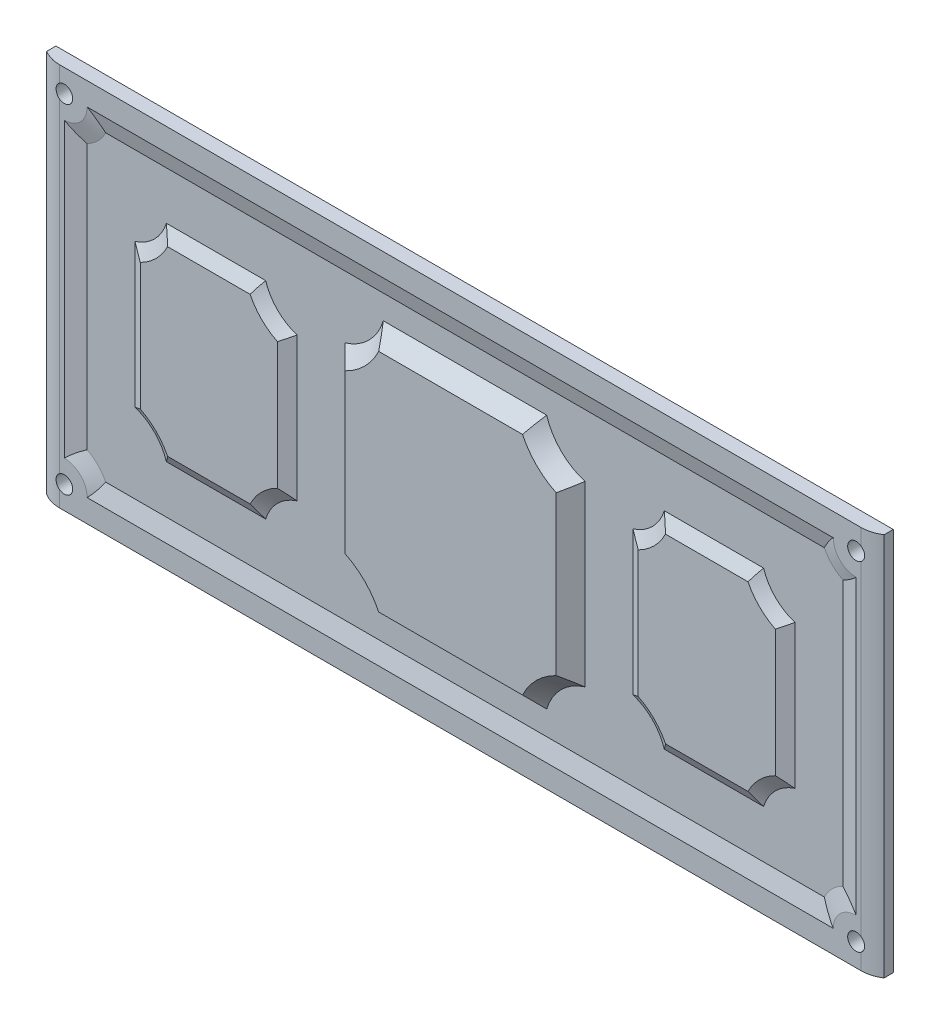
from build123d import *

# Parameters (mm, degrees)
SKETCH2_W           = 174.5
SKETCH2_H           = 80
BOSS_EXTRUDE1_DEPTH = 3
SKETCH3_R           = 1.75
CUT_EXTRUDE1_DEPTH  = 3
CUT_EXTRUDE2_DEPTH  = 1
CUT_EXTRUDE2_DRAFT  = -75
CUT_EXTRUDE3_REACH  = 120.413
BOSS_EXTRUDE2_DEPTH = 3
BOSS_EXTRUDE2_TAPER = 45
BOSS_EXTRUDE3_DEPTH = 1.5
BOSS_EXTRUDE3_TAPER = 60


# Read off the part's stored shape, not the designer's step: Cut-Extrude2
with BuildPart() as part:
    # Sketch2 → Boss-Extrude1 (new body)
    with BuildSketch(Plane.XY):
        Rectangle(SKETCH2_W, SKETCH2_H)
    extrude(amount=BOSS_EXTRUDE1_DEPTH)

    # Sketch3 → Cut-Extrude1 (cut)
    with BuildSketch(Plane.XY.offset(3)):
        with Locations((-82.5, 35.25)):
            Circle(SKETCH3_R)
        with Locations((82.5, 35.25)):
            Circle(SKETCH3_R)
        with Locations((82.5, -35.25)):
            Circle(SKETCH3_R)
        with Locations((-82.5, -35.25)):
            Circle(SKETCH3_R)
    extrude(amount=-CUT_EXTRUDE1_DEPTH, mode=Mode.SUBTRACT)


with BuildPart() as cut_extrude2_tool:
    # Cut-Extrude2 outline → Cut-Extrude2 (with draft: the straight prism first)
    with BuildSketch(Plane.XY.offset(2)):
        with BuildLine():
            ThreePointArc((-74.883112009, 31.517949192), (-76.502284356, 29.252284356), (-78.767949192, 27.633112009))
            Line((-78.767949192, 27.633112009), (-78.767949192, -27.633112009))
            ThreePointArc((-78.767949192, -27.633112009), (-76.502284356, -29.252284356), (-74.883112009, -31.517949192))
            Line((-74.883112009, -31.517949192), (74.883112009, -31.517949192))
            ThreePointArc((74.883112009, -31.517949192), (76.502284356, -29.252284356), (78.767949192, -27.633112009))
            Line((78.767949192, -27.633112009), (78.767949192, 27.633112009))
            ThreePointArc((78.767949192, 27.633112009), (76.502284356, 29.252284356), (74.883112009, 31.517949192))
            Line((74.883112009, 31.517949192), (-74.883112009, 31.517949192))
        make_face()
    extrude(amount=CUT_EXTRUDE2_DEPTH)
    # Cut-Extrude2: the draft: its side faces are tilted about the plane it starts from
    cut_extrude2_sides = [cut_extrude2_tool.faces().sort_by_distance(p)[0] for p in [
        (-76.502284356, 29.252284356, 2.5),
        (-78.767949192, 0, 2.5),
        (-76.502284356, -29.252284356, 2.5),
        (0, -31.517949192, 2.5),
        (76.502284356, -29.252284356, 2.5),
        (78.767949192, 0, 2.5),
        (76.502284356, 29.252284356, 2.5),
        (0, 31.517949192, 2.5),
    ]]
    draft(cut_extrude2_sides, Plane.XY.offset(2), CUT_EXTRUDE2_DRAFT)


with BuildPart() as part_1:
    add(part.part)

    # Cut-Extrude2: cut by cut_extrude2_tool
    add(cut_extrude2_tool.part, mode=Mode.SUBTRACT)

    # Sketch5 → Cut-Extrude3 (cut, up to next)
    with BuildSketch(Plane(origin=(0, 40, 0), x_dir=(1, 0, 0), z_dir=(0, 1, 0)), mode=Mode.PRIVATE) as cut_extrude3_sk1:
        with BuildLine():
            Line((-87.25, -1.910795209), (-87.25, -3))
            Line((-87.25, -3), (-83.5, -3))
            ThreePointArc((-83.5, -3), (-85.45248989, -2.722185897), (-87.25, -1.910795209))
        make_face()
    cut_extrude3_tool1 = extrude(cut_extrude3_sk1.sketch, amount=-CUT_EXTRUDE3_REACH, mode=Mode.PRIVATE) & part_1.part
    cut_extrude3 = cut_extrude3_tool1.solids().sort_by_distance((-86.327713, 40, 2.678112))[0]
    add(cut_extrude3, mode=Mode.SUBTRACT)

    # Mirror1: Cut-Extrude3 across plane
    add(cut_extrude3.mirror(Plane(origin=(0, 0, 0), x_dir=(0, 0, 1), z_dir=(1, 0, 0))), mode=Mode.SUBTRACT)

    # Sketch6 → Boss-Extrude2 (add)
    with BuildSketch(Plane.XY.offset(2)):
        with BuildLine():
            Line((-25, 18.539708909), (-25, -18.539708909))
            ThreePointArc((-25, -18.539708909), (-20.014718626, -21.532667818), (-17.021759717, -26.517949192))
            Line((-17.021759717, -26.517949192), (17.021759717, -26.517949192))
            ThreePointArc((17.021759717, -26.517949192), (20.014718626, -21.532667818), (25, -18.539708909))
            Line((25, -18.539708909), (25, 18.539708909))
            ThreePointArc((25, 18.539708909), (20.014718626, 21.532667818), (17.021759717, 26.517949192))
            Line((17.021759717, 26.517949192), (-17.021759717, 26.517949192))
            ThreePointArc((-17.021759717, 26.517949192), (-20.014718626, 21.532667818), (-25, 18.539708909))
        make_face()
    extrude(amount=BOSS_EXTRUDE2_DEPTH, taper=BOSS_EXTRUDE2_TAPER)

    # Sketch7 → Boss-Extrude3 (add)
    with BuildSketch(Plane.XY.offset(2)):
        with BuildLine():
            ThreePointArc((-68.767949192, -14.978557178), (-64.696881381, -17.446881381), (-62.228557178, -21.517949192))
            Line((-62.228557178, -21.517949192), (-41.539392014, -21.517949192))
            ThreePointArc((-41.539392014, -21.517949192), (-39.071067812, -17.446881381), (-35, -14.978557178))
            Line((-35, -14.978557178), (-35, 14.978557178))
            ThreePointArc((-35, 14.978557178), (-39.071067812, 17.446881381), (-41.539392014, 21.517949192))
            Line((-41.539392014, 21.517949192), (-62.228557178, 21.517949192))
            ThreePointArc((-62.228557178, 21.517949192), (-64.696881381, 17.446881381), (-68.767949192, 14.978557178))
            Line((-68.767949192, 14.978557178), (-68.767949192, -14.978557178))
        make_face()
    boss_extrude3 = extrude(amount=BOSS_EXTRUDE3_DEPTH, taper=BOSS_EXTRUDE3_TAPER)

    # Mirror2: Boss-Extrude3 across plane
    add(boss_extrude3.mirror(Plane(origin=(0, 0, 0), x_dir=(0, 0, 1), z_dir=(1, 0, 0))))


solid = part_1.part
